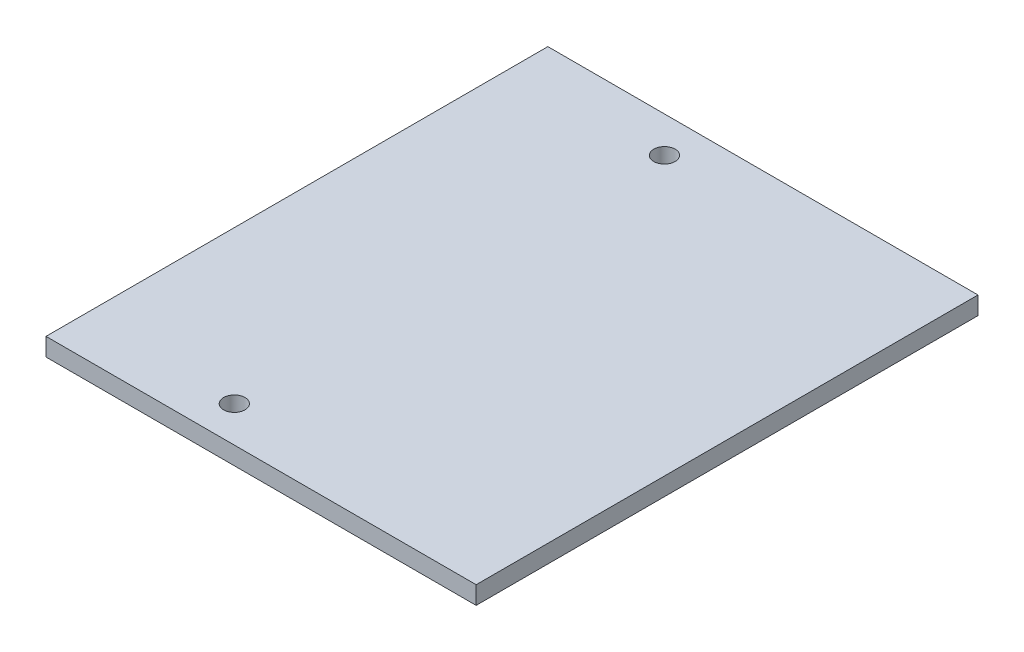
from build123d import *

# Parameters (mm, degrees)
SKETCH1_W             = 76.2
SKETCH1_H             = 88.9
BOSS_EXTRUDE1_DEPTH   = 3.175
F_6_CLEARANCE_HOLE1_D = 3.7973


with BuildPart() as part:
    # Sketch1 → Boss-Extrude1 (new body)
    with BuildSketch(Plane(origin=(0, 0, 0), x_dir=(1, 0, 0), z_dir=(0, 1, 0))):
        Rectangle(SKETCH1_W, SKETCH1_H)
    extrude(amount=BOSS_EXTRUDE1_DEPTH)

    # #6 Clearance Hole1 (through all)
    with Locations(Plane(origin=(-11.08964, 3.175, -38.1), x_dir=(0, 0, 1), z_dir=(0, 1, 0))):
        with Locations((0, 0), (76.2, 0)):
            Hole(F_6_CLEARANCE_HOLE1_D / 2)


solid = part.part
